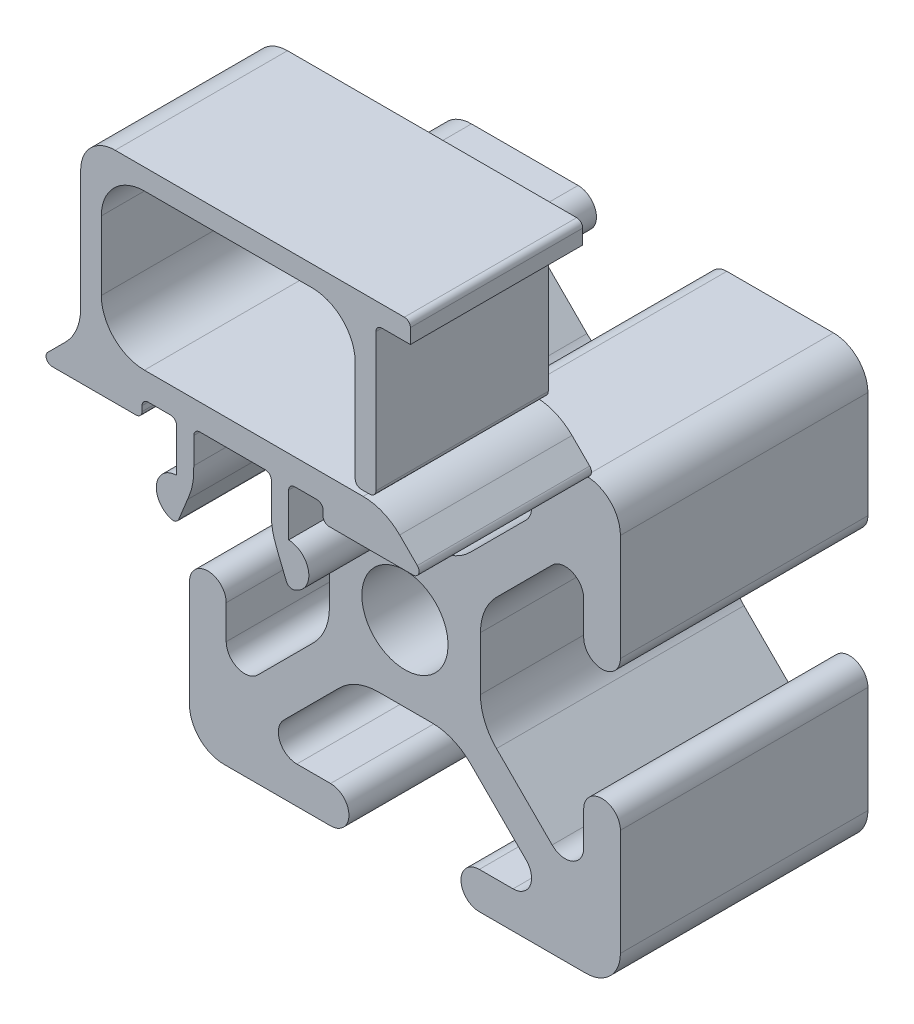
from build123d import *

# Parameters (mm, degrees)
SKETCH11_R                             = 2.5
F_25_SERIES_EXTRUSIONS_25_2525_1_DEPTH = 14.359821885
BOSS_EXTRUDE1_DEPTH                    = 10
BOSS_EXTRUDE3_DEPTH                    = 10
FILLET_R0_35_R                         = 0.35
FILLET2_R                              = 2.5
FILLET_R3_0_R                          = 3
FILLET4_R                              = 2


with BuildPart() as part:
    # Sketch11 → 25 series extrusions 25-2525(1) (new body)
    with BuildSketch(Plane(origin=(0, 0, 0), x_dir=(-1, 0, 0), z_dir=(0, 0, -1))):
        with BuildLine():
            Line((12.5, -10.5), (12.5, -4.315))
            ThreePointArc((12.5, -4.315), (11.435, -3.25), (10.37, -4.315))
            Line((10.37, -4.315), (10.37, -6.272801987))
            ThreePointArc((10.37, -6.272801987), (9.708114403, -7.263383786), (8.539643501, -7.030960473))
            Line((8.539643501, -7.030960473), (5.311043881, -3.802360852))
            ThreePointArc((5.311043881, -3.802360852), (4.622790395, -2.77231672), (4.381107911, -1.557296822))
            Line((4.381107911, -1.557296822), (4.381107911, 1.557296822))
            ThreePointArc((4.381107911, 1.557296822), (4.622790395, 2.77231672), (5.311043881, 3.802360852))
            Line((5.311043881, 3.802360852), (8.539643501, 7.030960473))
            ThreePointArc((8.539643501, 7.030960473), (9.708114403, 7.263383786), (10.37, 6.272801987))
            Line((10.37, 6.272801987), (10.37, 4.315))
            ThreePointArc((10.37, 4.315), (11.435, 3.25), (12.5, 4.315))
            Line((12.5, 4.315), (12.5, 10.5))
            ThreePointArc((12.5, 10.5), (11.914213562, 11.914213562), (10.5, 12.5))
            Line((10.5, 12.5), (4.315, 12.5))
            ThreePointArc((4.315, 12.5), (3.25, 11.435), (4.315, 10.37))
            Line((4.315, 10.37), (6.272801987, 10.37))
            ThreePointArc((6.272801987, 10.37), (7.263383786, 9.708114403), (7.030960473, 8.539643501))
            Line((7.030960473, 8.539643501), (3.802360852, 5.311043881))
            ThreePointArc((3.802360852, 5.311043881), (2.77231672, 4.622790395), (1.557296822, 4.381107911))
            Line((1.557296822, 4.381107911), (-1.557296822, 4.381107911))
            ThreePointArc((-1.557296822, 4.381107911), (-2.77231672, 4.622790395), (-3.802360852, 5.311043881))
            Line((-3.802360852, 5.311043881), (-7.030960473, 8.539643501))
            ThreePointArc((-7.030960473, 8.539643501), (-7.263383786, 9.708114403), (-6.272801987, 10.37))
            Line((-6.272801987, 10.37), (-4.315, 10.37))
            ThreePointArc((-4.315, 10.37), (-3.25, 11.435), (-4.315, 12.5))
            Line((-4.315, 12.5), (-10.5, 12.5))
            ThreePointArc((-10.5, 12.5), (-11.914213562, 11.914213562), (-12.5, 10.5))
            Line((-12.5, 10.5), (-12.5, 4.315))
            ThreePointArc((-12.5, 4.315), (-11.435, 3.25), (-10.37, 4.315))
            Line((-10.37, 4.315), (-10.37, 6.272801987))
            ThreePointArc((-10.37, 6.272801987), (-9.708114403, 7.263383786), (-8.539643501, 7.030960473))
            Line((-8.539643501, 7.030960473), (-5.311043881, 3.802360852))
            ThreePointArc((-5.311043881, 3.802360852), (-4.622790395, 2.77231672), (-4.381107911, 1.557296822))
            Line((-4.381107911, 1.557296822), (-4.381107911, -1.557296822))
            ThreePointArc((-4.381107911, -1.557296822), (-4.622790395, -2.77231672), (-5.311043881, -3.802360852))
            Line((-5.311043881, -3.802360852), (-8.539643501, -7.030960473))
            ThreePointArc((-8.539643501, -7.030960473), (-9.708114403, -7.263383786), (-10.37, -6.272801987))
            Line((-10.37, -6.272801987), (-10.37, -4.315))
            ThreePointArc((-10.37, -4.315), (-11.435, -3.25), (-12.5, -4.315))
            Line((-12.5, -4.315), (-12.5, -10.5))
            ThreePointArc((-12.5, -10.5), (-11.914213562, -11.914213562), (-10.5, -12.5))
            Line((-10.5, -12.5), (-4.315, -12.5))
            ThreePointArc((-4.315, -12.5), (-3.25, -11.435), (-4.315, -10.37))
            Line((-4.315, -10.37), (-6.272801987, -10.37))
            ThreePointArc((-6.272801987, -10.37), (-7.263383786, -9.708114403), (-7.030960473, -8.539643501))
            Line((-7.030960473, -8.539643501), (-3.802360852, -5.311043881))
            ThreePointArc((-3.802360852, -5.311043881), (-2.77231672, -4.622790395), (-1.557296822, -4.381107911))
            Line((-1.557296822, -4.381107911), (1.557296822, -4.381107911))
            ThreePointArc((1.557296822, -4.381107911), (2.77231672, -4.622790395), (3.802360852, -5.311043881))
            Line((3.802360852, -5.311043881), (7.030960473, -8.539643501))
            ThreePointArc((7.030960473, -8.539643501), (7.263383786, -9.708114403), (6.272801987, -10.37))
            Line((6.272801987, -10.37), (4.315, -10.37))
            ThreePointArc((4.315, -10.37), (3.25, -11.435), (4.315, -12.5))
            Line((4.315, -12.5), (10.5, -12.5))
            ThreePointArc((10.5, -12.5), (11.914213562, -11.914213562), (12.5, -10.5))
        make_face()
        Circle(SKETCH11_R, mode=Mode.SUBTRACT)
    extrude(amount=F_25_SERIES_EXTRUSIONS_25_2525_1_DEPTH)


with BuildPart() as body_2:
    # Sketch14 → Boss-Extrude1 (new body)
    with BuildSketch(Plane.XY):
        with BuildLine():
            Line((-11.315, 12.5), (-8.815, 15))
            Line((-8.815, 15), (8.815, 15))
            Line((8.815, 15), (11.315, 12.5))
            Line((11.315, 12.5), (5.25, 12.5))
            Line((5.25, 12.5), (5.25, 13.5))
            Line((5.25, 13.5), (3.25, 13.5))
            Line((3.25, 13.5), (3.25, 10.65))
            ThreePointArc((3.25, 10.65), (4.423527877, 9.437089868), (3.223600485, 8.250290424))
            Line((3.223600485, 8.250290424), (2.25, 10.65))
            Line((2.25, 10.65), (2.25, 13.5))
            Line((2.25, 13.5), (-2.25, 13.5))
            Line((-2.25, 13.5), (-2.25, 10.65))
            Line((-2.25, 10.65), (-3.223600485, 8.250290424))
            ThreePointArc((-3.223600485, 8.250290424), (-4.423527877, 9.437089868), (-3.25, 10.65))
            Line((-3.25, 10.65), (-3.25, 13.5))
            Line((-3.25, 13.5), (-5.25, 13.5))
            Line((-5.25, 13.5), (-5.25, 12.5))
            Line((-5.25, 12.5), (-11.315, 12.5))
        make_face()
    extrude(amount=BOSS_EXTRUDE1_DEPTH)

    # Sketch15 → Boss-Extrude3 (add)
    with BuildSketch(Plane.XY):
        Polygon((-8.815, 15), (-8.815, 25.2), (10.315, 25.2), (10.315, 24), (8.315, 24), (8.315, 15.3), (7.115, 15.3), (7.115, 24), (-7.615, 24), (-7.615, 15), align=None)
    extrude(amount=BOSS_EXTRUDE3_DEPTH)

    # r0.35
    fillet_r0_35_edges = [body_2.edges().sort_by_distance(p)[0] for p in [
        (-11.315, 12.5, 5),
        (11.315, 12.5, 5),
        (5.25, 12.5, 5),
        (5.25, 13.5, 5),
        (3.25, 13.5, 5),
        (3.223600485, 8.250290424, 5),
        (2.25, 13.5, 5),
        (-2.25, 13.5, 5),
        (-3.223600485, 8.250290424, 5),
        (-3.25, 13.5, 5),
        (-5.25, 13.5, 5),
        (-5.25, 12.5, 5),
        (7.115, 15.3, 5),
        (8.315, 15.3, 5),
        (8.315, 24, 5),
        (10.315, 25.2, 5),
    ]]
    fillet(fillet_r0_35_edges, radius=FILLET_R0_35_R)

    # r5.0
    # a fillet whose section is not a circle: 5 mm, written as the material it takes off along each edge
    with BuildSketch(Plane(origin=(2.25, 10.65, -2.439171554), x_dir=(0, 1, 0), z_dir=(0, 0, 1)), Plane(origin=(-2.25, 10.65, -2.439171554), x_dir=(-0.3759522508024761, -0.9266390371210097, 0), z_dir=(0, 0, 1))) as fillet_r5_0_piece_1:
        with BuildLine():
            add(Edge.make_bspline([(0.975668622, 0), (0.793756187, 0), (0.611843752, 0), (0.20704727, -0.015883221), (-0.18588675, -0.0925579), (-0.566958306, -0.230024036), (-0.735525469, -0.298414425), (-0.904092632, -0.366804814)], knots=[0, 0, 0, 0, 0, 0, 0.5, 0.5, 1, 1, 1, 1, 1, 1], degree=5))
            Line((-0.904092632, -0.366804814), (0, 0))
            Line((0, 0), (0.975668622, 0))
        make_face()
    extrude(amount=14.878343109, mode=Mode.SUBTRACT)

    # Fillet2
    fillet2_edges = [body_2.edges().sort_by_distance(p)[0] for p in [
        (-7.615, 15, 5),
        (-7.615, 24, 5),
        (7.115, 24, 5),
    ]]
    fillet(fillet2_edges, radius=FILLET2_R)

    # r3.0
    fillet_r3_0_edges = [body_2.edges().sort_by_distance(p)[0] for p in [
        (-8.815, 15, 5),
        (8.815, 15, 5),
    ]]
    fillet(fillet_r3_0_edges, radius=FILLET_R3_0_R)

    # Fillet4
    fillet4_edges = [body_2.edges().sort_by_distance(p)[0] for p in [
        (-8.815, 25.2, 5),
    ]]
    fillet(fillet4_edges, radius=FILLET4_R)


solid = Compound([part.part, body_2.part])
